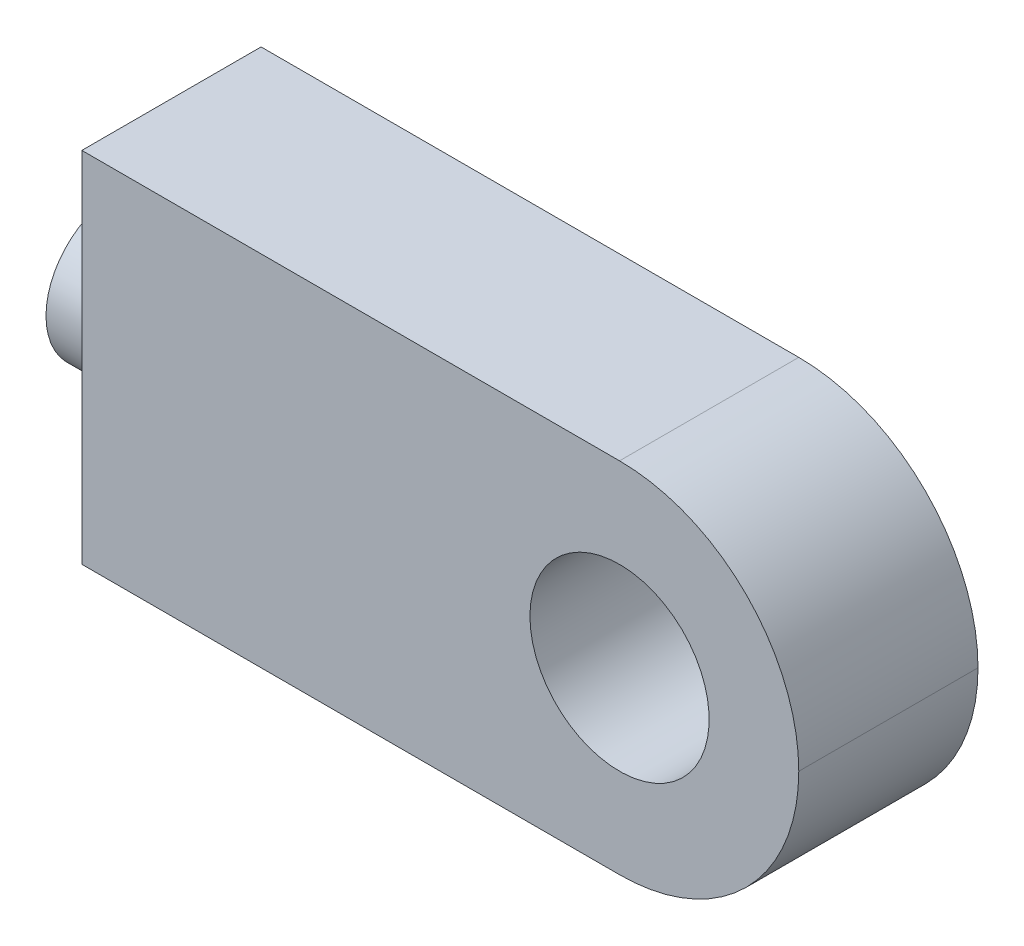
from build123d import *

# Parameters (mm, degrees)
SKETCH_2_W          = 80
SKETCH_2_H          = 40
EXTRUDE_1_DEPTH     = 10
FILLET_3_R          = 20
CUT_EXTRUDE_6_REACH = 50.99
SKETCH_8_R          = 10
SKETCH_9_R          = 8
EXTRUDE_2_DEPTH     = 6


with BuildPart() as part:
    # 草图2 → 凸台-拉伸1 (new, symmetric)
    with BuildSketch(Plane.XY):
        Rectangle(SKETCH_2_W, SKETCH_2_H)
    extrude(amount=EXTRUDE_1_DEPTH, both=True)

    # 圆角3
    fillet_3_edges = [part.edges().sort_by_distance(p)[0] for p in [
        (40, -20, 0),
        (40, 20, 0),
    ]]
    fillet(fillet_3_edges, radius=FILLET_3_R - 0.0001)  # a hair under: the kernel refuses the full size

    # 草图8 → 切除-拉伸6 (cut, up to next)
    with BuildSketch(Plane(origin=(0, 0, -10), x_dir=(-1, 0, 0), z_dir=(0, 0, -1)), mode=Mode.PRIVATE) as cut_extrude_6_sk1:
        with Locations((-20, 0)):
            Circle(SKETCH_8_R)
    cut_extrude_6_tool1 = extrude(cut_extrude_6_sk1.sketch, amount=-CUT_EXTRUDE_6_REACH, mode=Mode.PRIVATE) & part.part
    add(cut_extrude_6_tool1.solids().sort_by_distance((20, 0, -10))[0], mode=Mode.SUBTRACT)

    # 草图9 → 凸台-拉伸2 (add)
    with BuildSketch(Plane.ZY.offset(40)):
        Circle(SKETCH_9_R)
    extrude(amount=EXTRUDE_2_DEPTH)


solid = part.part
